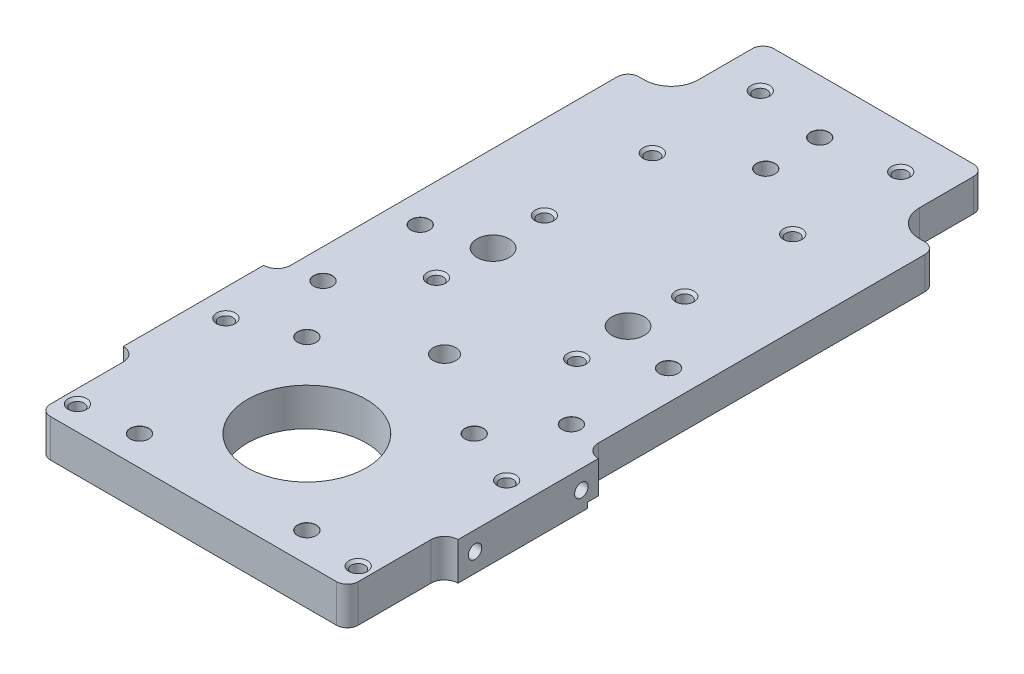
from build123d import *

# Parameters (mm, degrees)
PLATE_MAIN_SKETCH_R                          = 11
PLATE_MAIN_SKETCH_R_2                        = 3
EXTRUDE_PLATE_MAIN_DEPTH                     = 7
CORNER_FILLETS_R                             = 2
M3X0_5_TAPPED_HOLES_AT_2_COUNT               = 2
M3X0_5_TAPPED_HOLES_AT_2_PITCH               = 27.5
M3X0_5_TAPPED_HOLES_AT_3_COUNT               = 2
M3X0_5_TAPPED_HOLES_AT_3_PITCH               = 58.823889705
M3X0_5_TAPPED_HOLES_AT_4_COUNT               = 2
M3X0_5_TAPPED_HOLES_AT_4_PITCH               = 66.206117542
M3X0_5_TAPPED_HOLES_AT_5_COUNT               = 2
M3X0_5_TAPPED_HOLES_AT_5_PITCH               = 83.20606949
M3X0_5_TAPPED_HOLES_AT_6_COUNT               = 2
M3X0_5_TAPPED_HOLES_AT_6_PITCH               = 101.307699609
M3X0_5_TAPPED_HOLES_AT_7_COUNT               = 2
M3X0_5_TAPPED_HOLES_AT_7_PITCH               = 120.013540903
M3X0_5_TAPPED_HOLES_AT_8_COUNT               = 2
M3X0_5_TAPPED_HOLES_AT_8_PITCH               = 114.242067558
M3X0_5_TAPPED_HOLES_AT_9_COUNT               = 2
M3X0_5_TAPPED_HOLES_AT_9_PITCH               = 94.399417371
M3X0_5_TAPPED_HOLES_AT_10_COUNT              = 2
M3X0_5_TAPPED_HOLES_AT_10_PITCH              = 74.640806534
M3X0_5_TAPPED_HOLES_AT_11_COUNT              = 2
M3X0_5_TAPPED_HOLES_AT_11_PITCH              = 55.056788864
M3X0_5_TAPPED_HOLES_AT_12_COUNT              = 2
M3X0_5_TAPPED_HOLES_AT_12_PITCH              = 52
M3_COUNTER_BORES_AT_2_COUNT                  = 2
M3_COUNTER_BORES_AT_2_PITCH                  = 31
M3_COUNTER_BORES_AT_3_COUNT                  = 2
M3_COUNTER_BORES_AT_3_PITCH                  = 43.840620434
M3_COUNTER_BORES_AT_4_COUNT                  = 2
M3_COUNTER_BORES_AT_4_PITCH                  = 31
M3_COUNTER_BORES_AT_5_COUNT                  = 2
M3_COUNTER_BORES_AT_5_PITCH                  = 42.172265768
M3_COUNTER_BORES_AT_6_COUNT                  = 2
M3_COUNTER_BORES_AT_6_PITCH                  = 56.608303278
M3_COUNTER_BORES_AT_7_COUNT                  = 2
M3_COUNTER_BORES_AT_7_PITCH                  = 70.86959856
M3_COUNTER_BORES_AT_8_COUNT                  = 2
M3_COUNTER_BORES_AT_8_PITCH                  = 59.970826241
M3_COUNTER_BORES_AT_9_COUNT                  = 2
M3_COUNTER_BORES_AT_9_PITCH                  = 101.688249075
M3_COUNTER_BORES_AT_10_COUNT                 = 2
M3_COUNTER_BORES_AT_10_PITCH                 = 111.581808553
M5X0_8_TAPPED_HOLE1_D                        = 4.2
CUT_RECESS_DEPTH                             = 1
LEFT_Z_AXIS_SENSORS_M3X0_5_TAPPED_HO_2_COUNT = 2
LEFT_Z_AXIS_SENSORS_M3X0_5_TAPPED_HO_2_PITCH = 19.7


with BuildPart() as part:
    # Plate Main Sketch → Extrude Plate Main (new body)
    with BuildSketch(Plane(origin=(-158.085545862, 0, 24.679095537), x_dir=(-1, 0, 0), z_dir=(0, 1, 0))):
        with BuildLine():
            Line((-178.585545862, -24.679095537), (-137.585545862, -24.679095537))
            Line((-137.585545862, -24.679095537), (-137.585545862, -12.679095537))
            ThreePointArc((-137.585545862, -12.679095537), (-136.121079768, -9.143561631), (-132.585545862, -7.679095537))
            Line((-132.585545862, -7.679095537), (-129.585545862, -7.679095537))
            Line((-129.585545862, -7.679095537), (-129.585545862, 54.820904463))
            ThreePointArc((-129.585545862, 54.820904463), (-128.853312815, 56.588671416), (-127.085545862, 57.320904463))
            Line((-127.085545862, 57.320904463), (-127.085545862, 83.320904463))
            ThreePointArc((-127.085545862, 83.320904463), (-128.853312815, 84.05313751), (-129.585545862, 85.820904463))
            Line((-129.585545862, 85.820904463), (-129.585545862, 101.320904463))
            Line((-129.585545862, 101.320904463), (-186.585545862, 101.320904463))
            Line((-186.585545862, 101.320904463), (-186.585545862, 85.820904463))
            ThreePointArc((-186.585545862, 85.820904463), (-187.317778909, 84.05313751), (-189.085545862, 83.320904463))
            Line((-189.085545862, 83.320904463), (-189.085545862, 57.320904463))
            ThreePointArc((-189.085545862, 57.320904463), (-187.317778909, 56.588671416), (-186.585545862, 54.820904463))
            Line((-186.585545862, 54.820904463), (-186.585545862, -7.679095537))
            Line((-186.585545862, -7.679095537), (-183.585545862, -7.679095537))
            ThreePointArc((-183.585545862, -7.679095537), (-180.050011956, -9.143561631), (-178.585545862, -12.679095537))
            Line((-178.585545862, -12.679095537), (-178.585545862, -24.679095537))
        make_face()
        with Locations((-158.085545862, 80.320904463)):
            Circle(PLATE_MAIN_SKETCH_R, mode=Mode.SUBTRACT)
        with Locations((-145.585545862, 33.320904463)):
            Circle(PLATE_MAIN_SKETCH_R_2, mode=Mode.SUBTRACT)
        with Locations((-170.585545862, 33.320904463)):
            Circle(PLATE_MAIN_SKETCH_R_2, mode=Mode.SUBTRACT)
    extrude(amount=EXTRUDE_PLATE_MAIN_DEPTH)

    # Corner Fillets
    corner_fillets_edges = [part.edges().sort_by_distance(p)[0] for p in [
        (-28.5, 3.5, 126),
        (-28.5, 3.5, 17),
        (-20.5, 3.5, 0),
        (20.5, 3.5, 0),
        (28.5, 3.5, 17),
        (28.5, 3.5, 126),
    ]]
    fillet(corner_fillets_edges, radius=CORNER_FILLETS_R)

    # Sketch13 → M3x0.5 Tapped Holes (revolve, cut)
    with BuildSketch(Plane(origin=(26, 0, 121.5), x_dir=(0, 0, -1), z_dir=(1, 0, 0))):
        Polygon((0, 0), (0, 7), (1.725, 7), (1.25, 6.525), (1.25, 0), align=None)
    m3x0_5_tapped_holes = revolve(axis=Axis((26, -6.35, 121.5), (0, 1, 0)), mode=Mode.SUBTRACT)

    # M3x0.5 Tapped Holes at 2: M3x0.5 Tapped Holes ×2
    with Locations(*[(0, 0, -i * M3X0_5_TAPPED_HOLES_AT_2_PITCH) for i in range(1, M3X0_5_TAPPED_HOLES_AT_2_COUNT)]):
        add(m3x0_5_tapped_holes, mode=Mode.SUBTRACT)

    # M3x0.5 Tapped Holes at 3: M3x0.5 Tapped Holes ×2
    with Locations(*[Vector(-0.8839945855497452, 0, -0.46749713658880765) * (i * M3X0_5_TAPPED_HOLES_AT_3_PITCH) for i in range(1, M3X0_5_TAPPED_HOLES_AT_3_COUNT)]):
        add(m3x0_5_tapped_holes, mode=Mode.SUBTRACT)

    # M3x0.5 Tapped Holes at 4: M3x0.5 Tapped Holes ×2
    with Locations(*[Vector(-0.5890694311623529, 0, -0.8080824247996377) * (i * M3X0_5_TAPPED_HOLES_AT_4_PITCH) for i in range(1, M3X0_5_TAPPED_HOLES_AT_4_COUNT)]):
        add(m3x0_5_tapped_holes, mode=Mode.SUBTRACT)

    # M3x0.5 Tapped Holes at 5: M3x0.5 Tapped Holes ×2
    with Locations(*[Vector(-0.46871580689935055, 0, -0.8833490206949294) * (i * M3X0_5_TAPPED_HOLES_AT_5_PITCH) for i in range(1, M3X0_5_TAPPED_HOLES_AT_5_COUNT)]):
        add(m3x0_5_tapped_holes, mode=Mode.SUBTRACT)

    # M3x0.5 Tapped Holes at 6: M3x0.5 Tapped Holes ×2
    with Locations(*[Vector(-0.38496580369162126, 0, -0.9229308370555532) * (i * M3X0_5_TAPPED_HOLES_AT_6_PITCH) for i in range(1, M3X0_5_TAPPED_HOLES_AT_6_COUNT)]):
        add(m3x0_5_tapped_holes, mode=Mode.SUBTRACT)

    # M3x0.5 Tapped Holes at 7: M3x0.5 Tapped Holes ×2
    with Locations(*[Vector(-0.32496333085967716, 0, -0.9457266167326497) * (i * M3X0_5_TAPPED_HOLES_AT_7_PITCH) for i in range(1, M3X0_5_TAPPED_HOLES_AT_7_COUNT)]):
        add(m3x0_5_tapped_holes, mode=Mode.SUBTRACT)

    # M3x0.5 Tapped Holes at 8: M3x0.5 Tapped Holes ×2
    with Locations(*[Vector(-0.113793458730633, 0, -0.993504428148219) * (i * M3X0_5_TAPPED_HOLES_AT_8_PITCH) for i in range(1, M3X0_5_TAPPED_HOLES_AT_8_COUNT)]):
        add(m3x0_5_tapped_holes, mode=Mode.SUBTRACT)

    # M3x0.5 Tapped Holes at 9: M3x0.5 Tapped Holes ×2
    with Locations(*[Vector(-0.13771271435815216, 0, -0.9904722148067102) * (i * M3X0_5_TAPPED_HOLES_AT_9_PITCH) for i in range(1, M3X0_5_TAPPED_HOLES_AT_9_COUNT)]):
        add(m3x0_5_tapped_holes, mode=Mode.SUBTRACT)

    # M3x0.5 Tapped Holes at 10: M3x0.5 Tapped Holes ×2
    with Locations(*[Vector(-0.17416746420246676, 0, -0.9847160476062541) * (i * M3X0_5_TAPPED_HOLES_AT_10_PITCH) for i in range(1, M3X0_5_TAPPED_HOLES_AT_10_COUNT)]):
        add(m3x0_5_tapped_holes, mode=Mode.SUBTRACT)

    # M3x0.5 Tapped Holes at 11: M3x0.5 Tapped Holes ×2
    with Locations(*[Vector(-0.23611983677697992, 0, -0.9717239436591096) * (i * M3X0_5_TAPPED_HOLES_AT_11_PITCH) for i in range(1, M3X0_5_TAPPED_HOLES_AT_11_COUNT)]):
        add(m3x0_5_tapped_holes, mode=Mode.SUBTRACT)

    # M3x0.5 Tapped Holes at 12: M3x0.5 Tapped Holes ×2
    with Locations(*[(-i * M3X0_5_TAPPED_HOLES_AT_12_PITCH, 0, 0) for i in range(1, M3X0_5_TAPPED_HOLES_AT_12_COUNT)]):
        add(m3x0_5_tapped_holes, mode=Mode.SUBTRACT)

    # Sketch5 → M3 Counter Bores (revolve, cut)
    with BuildSketch(Plane(origin=(-15.5, 0, 120.5), x_dir=(0, 0, -1), z_dir=(1, 0, 0))):
        Polygon((0, 0), (0, 7), (1.725, 7), (1.7, 6.975), (1.7, 4.5), (3, 4.5), (3, 0), align=None)
    m3_counter_bores = revolve(axis=Axis((-15.5, -6.35, 120.5), (0, 1, 0)), mode=Mode.SUBTRACT)

    # M3 Counter Bores at 2: M3 Counter Bores ×2
    with Locations(*[(i * M3_COUNTER_BORES_AT_2_PITCH, 0, 0) for i in range(1, M3_COUNTER_BORES_AT_2_COUNT)]):
        add(m3_counter_bores, mode=Mode.SUBTRACT)

    # M3 Counter Bores at 3: M3 Counter Bores ×2
    with Locations(*[Vector(0.7071067811865479, 0, -0.7071067811865472) * (i * M3_COUNTER_BORES_AT_3_PITCH) for i in range(1, M3_COUNTER_BORES_AT_3_COUNT)]):
        add(m3_counter_bores, mode=Mode.SUBTRACT)

    # M3 Counter Bores at 4: M3 Counter Bores ×2
    with Locations(*[(0, 0, -i * M3_COUNTER_BORES_AT_4_PITCH) for i in range(1, M3_COUNTER_BORES_AT_4_COUNT)]):
        add(m3_counter_bores, mode=Mode.SUBTRACT)

    # M3 Counter Bores at 5: M3 Counter Bores ×2
    with Locations(*[Vector(-0.1778419978967634, 0, -0.9840590550287557) * (i * M3_COUNTER_BORES_AT_5_PITCH) for i in range(1, M3_COUNTER_BORES_AT_5_COUNT)]):
        add(m3_counter_bores, mode=Mode.SUBTRACT)

    # M3 Counter Bores at 6: M3 Counter Bores ×2
    with Locations(*[Vector(0.6801122409730789, 0, -0.7331080000099417) * (i * M3_COUNTER_BORES_AT_6_PITCH) for i in range(1, M3_COUNTER_BORES_AT_6_COUNT)]):
        add(m3_counter_bores, mode=Mode.SUBTRACT)

    # M3 Counter Bores at 7: M3 Counter Bores ×2
    with Locations(*[Vector(0.5432512781572745, 0, -0.8395701571521512) * (i * M3_COUNTER_BORES_AT_7_PITCH) for i in range(1, M3_COUNTER_BORES_AT_7_COUNT)]):
        add(m3_counter_bores, mode=Mode.SUBTRACT)

    # M3 Counter Bores at 8: M3 Counter Bores ×2
    with Locations(*[Vector(-0.12506080823181873, 0, -0.9921490786390946) * (i * M3_COUNTER_BORES_AT_8_PITCH) for i in range(1, M3_COUNTER_BORES_AT_8_COUNT)]):
        add(m3_counter_bores, mode=Mode.SUBTRACT)

    # M3 Counter Bores at 9: M3 Counter Bores ×2
    with Locations(*[Vector(0.15242665834989907, 0, -0.9883147847848291) * (i * M3_COUNTER_BORES_AT_9_PITCH) for i in range(1, M3_COUNTER_BORES_AT_9_COUNT)]):
        add(m3_counter_bores, mode=Mode.SUBTRACT)

    # M3 Counter Bores at 10: M3 Counter Bores ×2
    with Locations(*[Vector(0.13891153227375555, 0, -0.9903047945967733) * (i * M3_COUNTER_BORES_AT_10_PITCH) for i in range(1, M3_COUNTER_BORES_AT_10_COUNT)]):
        add(m3_counter_bores, mode=Mode.SUBTRACT)

    # M5x0.8 Tapped Hole1 (through all)
    with Locations(Plane(origin=(0, 0, 0), x_dir=(-1, 0, 0), z_dir=(0, -1, 0))):
        with Locations((0, -79.5)):
            Hole(M5X0_8_TAPPED_HOLE1_D / 2)

    # Reccess Sketch → Cut Recess (cut)
    with BuildSketch(Plane(origin=(0, 0, 0), x_dir=(1, 0, 0), z_dir=(0, 1, 0))):
        with BuildLine():
            Line((-8.25, 0), (-8.25, -81))
            ThreePointArc((-8.25, -81), (-9.128679656, -83.121320344), (-11.25, -84))
            Line((-11.25, -84), (-31, -84))
            Line((-31, -84), (-31, 0))
            Line((-31, 0), (-8.25, 0))
        make_face()
        with BuildLine():
            Line((31, 0), (8.25, 0))
            Line((8.25, 0), (8.25, -81))
            ThreePointArc((8.25, -81), (9.128679656, -83.121320344), (11.25, -84))
            Line((11.25, -84), (31, -84))
            Line((31, -84), (31, 0))
        make_face()
    extrude(amount=CUT_RECESS_DEPTH, mode=Mode.SUBTRACT)

    # Sketch17 → Left Z-Axis Sensors M3x0.5 Tapped Holes (revolve, cut)
    with BuildSketch(Plane(origin=(-31, 3.5, 85.15), x_dir=(0, 0, 1), z_dir=(0, 1, 0))):
        Polygon((0, 0), (0, 10.751075774), (1.25, 10), (1.25, 0), align=None)
    left_z_axis_sensors_m3x0_5_tapped_holes = revolve(axis=Axis((-37.35, 3.5, 85.15), (1, 0, 0)), mode=Mode.SUBTRACT)

    # Left Z-Axis Sensors M3x0.5 Tapped Ho 2: Left Z-Axis Sensors M3x0.5 Tapped Holes ×2
    with Locations(*[(0, 0, i * LEFT_Z_AXIS_SENSORS_M3X0_5_TAPPED_HO_2_PITCH) for i in range(1, LEFT_Z_AXIS_SENSORS_M3X0_5_TAPPED_HO_2_COUNT)]):
        add(left_z_axis_sensors_m3x0_5_tapped_holes, mode=Mode.SUBTRACT)

    # Right Z-Axis Sensor Holes Mirror: Left Z-Axis Sensors M3x0.5 Tapped Holes across plane
    add(left_z_axis_sensors_m3x0_5_tapped_holes.mirror(Plane(origin=(0, 0, 0), x_dir=(0, 0, 1), z_dir=(1, 0, 0))), mode=Mode.SUBTRACT)

    # Right Z-Axis Sensor Holes Mirror copy 1 → Right Z-Axis Sensor Holes Mirror cop 2 (revolve, cut)
    with BuildSketch(Plane(origin=(31, 3.5, 104.85), x_dir=(0, 0, 1), z_dir=(0, 1, 0))):
        Polygon((0, 0), (0, -10.751075774), (1.25, -10), (1.25, 0), align=None)
    revolve(axis=Axis((37.35, 3.5, 104.85), (1, 0, 0)), mode=Mode.SUBTRACT)


solid = part.part
